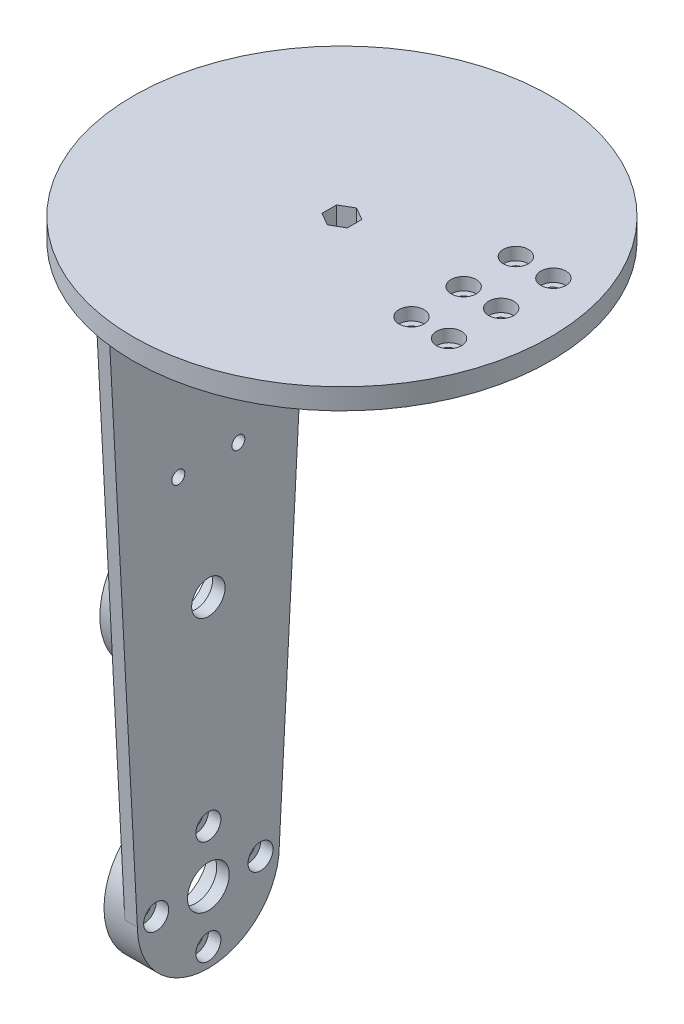
from build123d import *

# Parameters (mm, degrees)
SKETCH2_R               = 9
BOSS_EXTRUDE1_DEPTH     = 20
CUT_EXTRUDE1_DEPTH      = 20
SKETCH4_R               = 50
SKETCH4_R_2             = 3.995473389
BOSS_EXTRUDE3_DEPTH     = 5
CUT_EXTRUDE2_DEPTH      = 9
CUT_EXTRUDE2_DEPTH_BACK = 9
SKETCH11_R              = 1.55
CUT_EXTRUDE9_DEPTH      = 9
CUT_EXTRUDE9_DEPTH_BACK = 9
SKETCH15_R              = 1.55
SKETCH28_R              = 5
SKETCH28_R_2            = 4
SKETCH28_R_3            = 1.55
BOSS_EXTRUDE10_DEPTH    = 3
SKETCH25_R              = 17
SKETCH25_R_2            = 8
BOSS_EXTRUDE8_DEPTH     = 5
SKETCH26_R              = 1.55
CUT_EXTRUDE14_DEPTH     = 8
SKETCH27_R              = 3
CUT_EXTRUDE15_DEPTH     = 3
SKETCH16_R              = 1.55
CUT_EXTRUDE17_DEPTH     = 5
SKETCH29_R              = 3
CUT_EXTRUDE18_DEPTH     = 3
SKETCH30_R              = 17
SKETCH30_R_2            = 9.5
BOSS_EXTRUDE11_DEPTH    = 6
CUT_EXTRUDE23_START     = 9
SKETCH31_R              = 3
CUT_EXTRUDE23_DEPTH     = 2.5
CUT_EXTRUDE24_START     = -6.5
SKETCH31_3_R            = 3
CUT_EXTRUDE24_DEPTH     = 2.5
CUT_EXTRUDE25_START     = 9
SKETCH33_R              = 3
CUT_EXTRUDE25_DEPTH     = 2.5
CUT_EXTRUDE26_START     = -6.5
SKETCH33_2_R            = 3
CUT_EXTRUDE26_DEPTH     = 2.5


with BuildPart() as part:
    # Sketch2 → Boss-Extrude1 (new body)
    with BuildSketch(Plane(origin=(0, 0, 0), x_dir=(1, 0, 0), z_dir=(0, 1, 0))):
        Circle(SKETCH2_R)
    extrude(amount=BOSS_EXTRUDE1_DEPTH)

    # Sketch3 → Cut-Extrude1 (cut)
    with BuildSketch(Plane(origin=(0, 20, 0), x_dir=(1, 0, 0), z_dir=(0, 1, 0))):
        Polygon((0, 3.5), (-3.031088913, 1.75), (-3.031088913, -1.75), (0, -3.5), (3.031088913, -1.75), (3.031088913, 1.75), align=None)
    extrude(amount=-CUT_EXTRUDE1_DEPTH, mode=Mode.SUBTRACT)

    # Sketch4 → Boss-Extrude3 (add)
    with BuildSketch(Plane(origin=(0, 20, 0), x_dir=(1, 0, 0), z_dir=(0, 1, 0))):
        Circle(SKETCH4_R)
        Circle(SKETCH4_R_2, mode=Mode.SUBTRACT)
    extrude(amount=-BOSS_EXTRUDE3_DEPTH)

    # Sketch11 → Cut-Extrude2 (cut, two sides: drawn at the far end of the back side and taken through both)
    with BuildSketch(Plane(origin=(0, 0, 0), x_dir=(0.8660254037844348, 0, -0.5000000000000067), z_dir=(0.5000000000000067, 0, 0.8660254037844348)).offset(-CUT_EXTRUDE2_DEPTH_BACK)):
        with Locations((0, 5)):
            Circle(SKETCH11_R)
    extrude(amount=CUT_EXTRUDE2_DEPTH + CUT_EXTRUDE2_DEPTH_BACK, mode=Mode.SUBTRACT)

    # Sketch15 → Cut-Extrude9 (cut, two sides: drawn at the far end of the back side and taken through both)
    with BuildSketch(Plane(origin=(0, 0, 0), x_dir=(0, 0, -1), z_dir=(1, 0, 0)).offset(-CUT_EXTRUDE9_DEPTH_BACK)):
        with Locations((0, 9)):
            Circle(SKETCH15_R)
    extrude(amount=CUT_EXTRUDE9_DEPTH + CUT_EXTRUDE9_DEPTH_BACK, mode=Mode.SUBTRACT)

    # Sketch28 → Boss-Extrude10 (add)
    with BuildSketch(Plane.ZY.offset(32)):
        with BuildLine():
            Line((25, 15), (-25, 15))
            Line((-25, 15), (-17, -135))
            ThreePointArc((-17, -135), (0, -152), (17, -135))
            Line((17, -135), (25, 15))
        make_face()
        with Locations((0, -135)):
            Circle(SKETCH28_R, mode=Mode.SUBTRACT)
        with Locations((0, -75)):
            Circle(SKETCH28_R_2, mode=Mode.SUBTRACT)
        with Locations((7.186666667, -46.5)):
            Circle(SKETCH28_R_3, mode=Mode.SUBTRACT)
        with Locations((-7.186666667, -46.5)):
            Circle(SKETCH28_R_3, mode=Mode.SUBTRACT)
    extrude(amount=BOSS_EXTRUDE10_DEPTH)

    # Sketch25 → Boss-Extrude8 (add)
    with BuildSketch(Plane.ZY.offset(35)):
        with Locations((0, -135)):
            Circle(SKETCH25_R)
        with Locations((0, -135)):
            Circle(SKETCH25_R_2, mode=Mode.SUBTRACT)
    extrude(amount=BOSS_EXTRUDE8_DEPTH)

    # Sketch26 → Cut-Extrude14 (cut)
    with BuildSketch(Plane.ZY.offset(40)):
        with Locations((-12.5, -135)):
            Circle(SKETCH26_R)
        with Locations((0, -122.5)):
            Circle(SKETCH26_R)
        with Locations((12.5, -135)):
            Circle(SKETCH26_R)
        with Locations((0, -147.5)):
            Circle(SKETCH26_R)
    extrude(amount=-CUT_EXTRUDE14_DEPTH, mode=Mode.SUBTRACT)

    # Sketch27 → Cut-Extrude15 (cut)
    with BuildSketch(Plane(origin=(-32, 0, 0), x_dir=(0, 0, -1), z_dir=(1, 0, 0))):
        with Locations((-12.5, -135)):
            Circle(SKETCH27_R)
        with Locations((0, -122.5)):
            Circle(SKETCH27_R)
        with Locations((12.5, -135)):
            Circle(SKETCH27_R)
        with Locations((0, -147.5)):
            Circle(SKETCH27_R)
    extrude(amount=-CUT_EXTRUDE15_DEPTH, mode=Mode.SUBTRACT)

    # Sketch16 → Cut-Extrude17 (cut)
    with BuildSketch(Plane.XZ.offset(-15)):
        with Locations((29.154127235, 12.5)):
            Circle(SKETCH16_R)
        with Locations((29.154127235, 0)):
            Circle(SKETCH16_R)
        with Locations((29.154127235, -12.5)):
            Circle(SKETCH16_R)
        with Locations((38, -12.5)):
            Circle(SKETCH16_R)
        with Locations((38, 0)):
            Circle(SKETCH16_R)
        with Locations((38, 12.5)):
            Circle(SKETCH16_R)
    extrude(amount=-CUT_EXTRUDE17_DEPTH, mode=Mode.SUBTRACT)

    # Sketch29 → Cut-Extrude18 (cut)
    with BuildSketch(Plane(origin=(0, 20, 0), x_dir=(1, 0, 0), z_dir=(0, 1, 0))):
        with Locations((29.154127235, 12.5)):
            Circle(SKETCH29_R)
        with Locations((38.154127235, 12.5)):
            Circle(SKETCH29_R)
        with Locations((38.154127235, 0)):
            Circle(SKETCH29_R)
        with Locations((38.154127235, -12.5)):
            Circle(SKETCH29_R)
        with Locations((29.154127235, 0)):
            Circle(SKETCH29_R)
        with Locations((29.154127235, -12.5)):
            Circle(SKETCH29_R)
    extrude(amount=-CUT_EXTRUDE18_DEPTH, mode=Mode.SUBTRACT)

    # Sketch30 → Boss-Extrude11 (add)
    with BuildSketch(Plane.ZY.offset(35)):
        with Locations((0, -75)):
            Circle(SKETCH30_R)
        with Locations((0, -75)):
            Circle(SKETCH30_R_2, mode=Mode.SUBTRACT)
    extrude(amount=BOSS_EXTRUDE11_DEPTH)

    # Sketch31 → Cut-Extrude23 (cut)
    with BuildSketch(Plane(origin=(0, 0, 0), x_dir=(0.8660254037844348, 0, -0.5000000000000067), z_dir=(0.5000000000000067, 0, 0.8660254037844348)).offset(CUT_EXTRUDE23_START)):
        with Locations((0, 5)):
            Circle(SKETCH31_R)
    extrude(amount=-CUT_EXTRUDE23_DEPTH, mode=Mode.SUBTRACT)

    # Sketch31<3> → Cut-Extrude24 (cut)
    with BuildSketch(Plane(origin=(0, 0, 0), x_dir=(0.8660254037844348, 0, -0.5000000000000067), z_dir=(0.5000000000000067, 0, 0.8660254037844348)).offset(CUT_EXTRUDE24_START)):
        with Locations((0, 5)):
            Circle(SKETCH31_3_R)
    extrude(amount=-CUT_EXTRUDE24_DEPTH, mode=Mode.SUBTRACT)

    # Sketch33 → Cut-Extrude25 (cut)
    with BuildSketch(Plane(origin=(0, 0, 0), x_dir=(0, 0, -1), z_dir=(1, 0, 0)).offset(CUT_EXTRUDE25_START)):
        with Locations((0, 9)):
            Circle(SKETCH33_R)
    extrude(amount=-CUT_EXTRUDE25_DEPTH, mode=Mode.SUBTRACT)

    # Sketch33<2> → Cut-Extrude26 (cut)
    with BuildSketch(Plane(origin=(0, 0, 0), x_dir=(0, 0, -1), z_dir=(1, 0, 0)).offset(CUT_EXTRUDE26_START)):
        with Locations((0, 9)):
            Circle(SKETCH33_2_R)
    extrude(amount=-CUT_EXTRUDE26_DEPTH, mode=Mode.SUBTRACT)


solid = part.part
